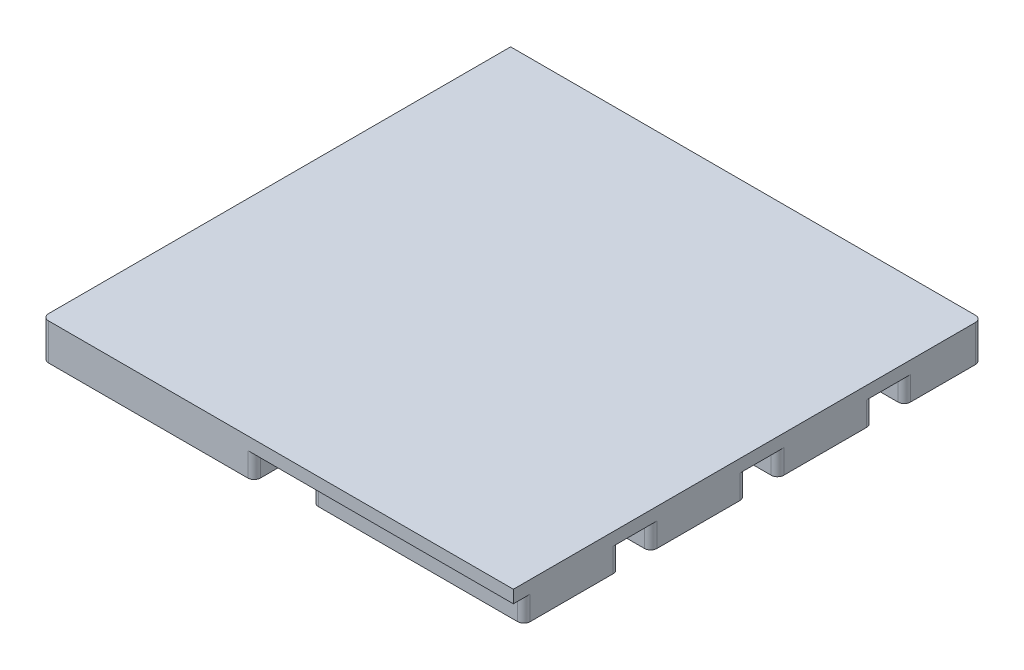
from build123d import *

# Parameters (mm, degrees)
SKETCH2_W           = 149
SKETCH2_H           = 148.13
BOSS_EXTRUDE1_DEPTH = 4
SKETCH3_W           = 67
SKETCH3_H           = 24.5
SKETCH3_H_2         = 30.2
SKETCH3_H_3         = 30.1967
BOSS_EXTRUDE3_DEPTH = 11.55
FILLET1_R           = 2


with BuildPart() as part:
    # Sketch2 → Boss-Extrude1 (new body)
    with BuildSketch(Plane(origin=(0, 0, 0), x_dir=(1, 0, 0), z_dir=(0, 1, 0))):
        with Locations((74.5, 74.065)):
            Rectangle(SKETCH2_W, SKETCH2_H)
    extrude(amount=BOSS_EXTRUDE1_DEPTH)

    # Sketch3 → Boss-Extrude3 (add)
    # profile 1 of 8: a face of its own
    with BuildSketch(Plane(origin=(0, 4, 0), x_dir=(1, 0, 0), z_dir=(0, 1, 0))):
        with Locations((115.5, 135.88)):
            Rectangle(SKETCH3_W, SKETCH3_H)
        with BuildLine():
            ThreePointArc((97.3, 136.48), (95.475, 138.305), (97.3, 140.13))
            Line((97.3, 140.13), (124.6, 140.13))
            ThreePointArc((124.6, 140.13), (126.425, 138.305), (124.6, 136.48))
            Line((124.6, 136.48), (97.3, 136.48))
        make_face(mode=Mode.SUBTRACT)
    # profile 2 of 8: a face of its own
    with BuildSketch(Plane(origin=(0, 4, 0), x_dir=(1, 0, 0), z_dir=(0, 1, 0))):
        with Locations((115.5, 98.63)):
            Rectangle(SKETCH3_W, SKETCH3_H_2)
        with BuildLine():
            ThreePointArc((97.3, 95.83), (95.5, 97.63), (97.3, 99.43))
            Line((97.3, 99.43), (124.6, 99.43))
            ThreePointArc((124.6, 99.43), (126.4, 97.63), (124.6, 95.83))
            Line((124.6, 95.83), (97.3, 95.83))
        make_face(mode=Mode.SUBTRACT)
    # profile 3 of 8: a face of its own
    with BuildSketch(Plane(origin=(0, 4, 0), x_dir=(1, 0, 0), z_dir=(0, 1, 0))):
        with Locations((33.5, 132.5467)):
            Rectangle(SKETCH3_W, SKETCH3_H)
        with BuildLine():
            ThreePointArc((12.85, 133.7967), (11.025, 135.6217), (12.85, 137.4467))
            Line((12.85, 137.4467), (40.15, 137.4467))
            ThreePointArc((40.15, 137.4467), (41.975, 135.6217), (40.15, 133.7967))
            Line((40.15, 133.7967), (12.85, 133.7967))
        make_face(mode=Mode.SUBTRACT)
    # profile 4 of 8: a face of its own
    with BuildSketch(Plane(origin=(0, 4, 0), x_dir=(1, 0, 0), z_dir=(0, 1, 0))):
        with Locations((115.5, 58.53)):
            Rectangle(SKETCH3_W, SKETCH3_H_2)
        with BuildLine():
            ThreePointArc((97.3, 55.73), (95.5, 57.53), (97.3, 59.33))
            Line((97.3, 59.33), (124.6, 59.33))
            ThreePointArc((124.6, 59.33), (126.4, 57.53), (124.6, 55.73))
            Line((124.6, 55.73), (97.3, 55.73))
        make_face(mode=Mode.SUBTRACT)
    # profile 5 of 8: a face of its own
    with BuildSketch(Plane(origin=(0, 4, 0), x_dir=(1, 0, 0), z_dir=(0, 1, 0))):
        with Locations((33.5, 95.2967)):
            Rectangle(SKETCH3_W, SKETCH3_H_2)
        with BuildLine():
            ThreePointArc((12.85, 92.4967), (11.05, 94.2967), (12.85, 96.0967))
            Line((12.85, 96.0967), (40.15, 96.0967))
            ThreePointArc((40.15, 96.0967), (41.95, 94.2967), (40.15, 92.4967))
            Line((40.15, 92.4967), (12.85, 92.4967))
        make_face(mode=Mode.SUBTRACT)
    # profile 6 of 8: a face of its own
    with BuildSketch(Plane(origin=(0, 4, 0), x_dir=(1, 0, 0), z_dir=(0, 1, 0))):
        with Locations((115.5, 18.43)):
            Rectangle(SKETCH3_W, SKETCH3_H_2)
        with BuildLine():
            ThreePointArc((97.3, 15.63), (95.5, 17.43), (97.3, 19.23))
            Line((97.3, 19.23), (124.6, 19.23))
            ThreePointArc((124.6, 19.23), (126.4, 17.43), (124.6, 15.63))
            Line((124.6, 15.63), (97.3, 15.63))
        make_face(mode=Mode.SUBTRACT)
    # profile 7 of 8: a face of its own
    with BuildSketch(Plane(origin=(0, 4, 0), x_dir=(1, 0, 0), z_dir=(0, 1, 0))):
        with Locations((33.5, 55.1967)):
            Rectangle(SKETCH3_W, SKETCH3_H_2)
        with BuildLine():
            ThreePointArc((12.85, 52.3967), (11.05, 54.1967), (12.85, 55.9967))
            Line((12.85, 55.9967), (40.15, 55.9967))
            ThreePointArc((40.15, 55.9967), (41.95, 54.1967), (40.15, 52.3967))
            Line((40.15, 52.3967), (12.85, 52.3967))
        make_face(mode=Mode.SUBTRACT)
    # profile 8 of 8: a face of its own
    with BuildSketch(Plane(origin=(0, 4, 0), x_dir=(1, 0, 0), z_dir=(0, 1, 0))):
        with Locations((33.5, 15.09835)):
            Rectangle(SKETCH3_W, SKETCH3_H_3)
        with BuildLine():
            ThreePointArc((12.85, 12.2967), (11.05, 14.0967), (12.85, 15.8967))
            Line((12.85, 15.8967), (40.15, 15.8967))
            ThreePointArc((40.15, 15.8967), (41.95, 14.0967), (40.15, 12.2967))
            Line((40.15, 12.2967), (12.85, 12.2967))
        make_face(mode=Mode.SUBTRACT)
    extrude(amount=-BOSS_EXTRUDE3_DEPTH)

    # Fillet1
    fillet1_edges = [part.edges().sort_by_distance(p)[0] for p in [
        (149, -3.775, -3.33),
        (149, -3.775, -33.53),
        (82, -3.775, -33.53),
        (82, -3.775, -3.33),
        (67, -3.775, 0),
        (0, -1.775, 0),
        (0, -3.775, -30.1967),
        (67, -3.775, -30.1967),
        (67, -3.775, -40.0967),
        (0, -3.775, -40.0967),
        (149, -3.775, -43.43),
        (82, -3.775, -43.43),
        (82, -3.775, -73.63),
        (67, -3.775, -70.2967),
        (0, -3.775, -70.2967),
        (0, -3.775, -80.1967),
        (82, -3.775, -83.53),
        (67, -3.775, -80.1967),
        (0, -3.775, -110.3967),
        (149, -3.775, -83.53),
        (149, -3.775, -73.63),
        (149, -3.775, -113.73),
        (67, -3.775, -110.3967),
        (82, -3.775, -113.73),
        (0, -3.775, -120.2967),
        (67, -3.775, -120.2967),
        (67, -3.775, -144.7967),
        (0, -3.775, -144.7967),
        (82, -3.775, -123.63),
        (149, -3.775, -123.63),
        (149, -1.775, -148.13),
        (82, -3.775, -148.13),
    ]]
    fillet(fillet1_edges, radius=FILLET1_R)


solid = part.part
